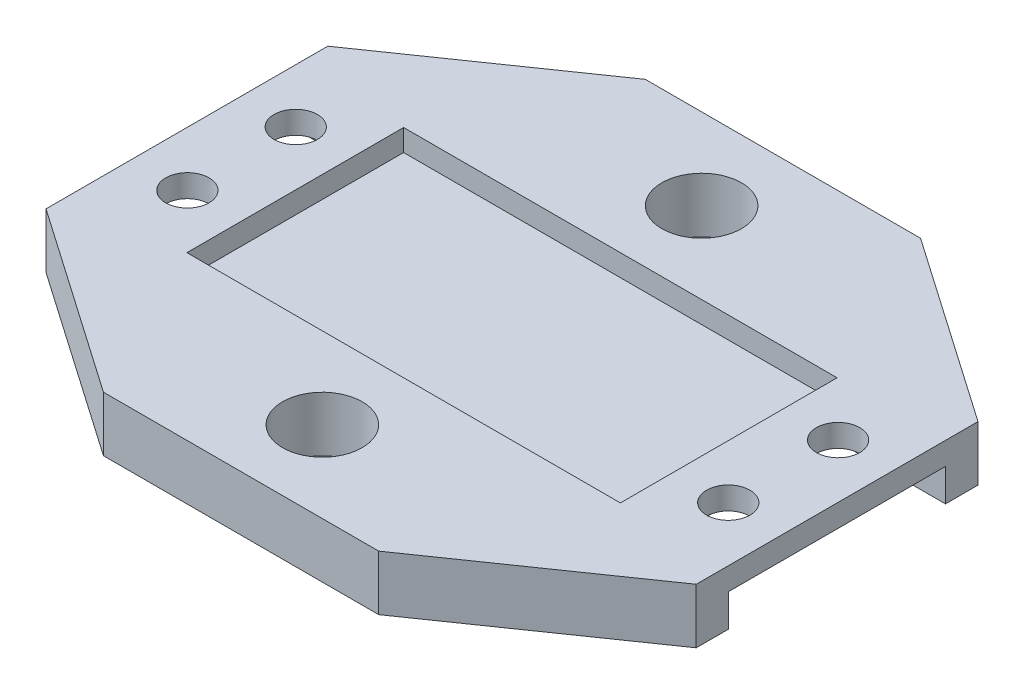
from build123d import *

# Parameters (mm, degrees)
SKETCH1_W           = 60
SKETCH1_H           = 50
BOSS_EXTRUDE1_DEPTH = 5.08
SKETCH2_OUTSIDE_W   = 77.654
SKETCH2_OUTSIDE_H   = 67.654
SKETCH2_OUTSIDE_R   = 3.675
CUT_EXTRUDE1_DEPTH  = 56.468381585
SKETCH12_W          = 20
SKETCH12_H          = 3
CUT_EXTRUDE6_DEPTH  = 10
SKETCH13_W          = 20
SKETCH13_H          = 3
CUT_EXTRUDE7_DEPTH  = 10
SKETCH14_W          = 40
SKETCH14_H          = 20
CUT_EXTRUDE8_DEPTH  = 2
SKETCH15_R          = 2
CUT_EXTRUDE9_DEPTH  = 56.468381585


with BuildPart() as part:
    # Sketch1 → Boss-Extrude1 (new body)
    with BuildSketch(Plane(origin=(0, 0, 0), x_dir=(1, 0, 0), z_dir=(0, 1, 0))):
        with Locations((-18.058684047, 2.226785401)):
            Rectangle(SKETCH1_W, SKETCH1_H)
    extrude(amount=BOSS_EXTRUDE1_DEPTH)

    # Sketch2 outside → Cut-Extrude1 (cut, through all)
    # profile 1 of 3: a face of its own
    with BuildSketch(Plane(origin=(0, 5.08, 0), x_dir=(1, 0, 0), z_dir=(0, 1, 0))):
        with Locations((-18.059, 2.227)):
            Rectangle(SKETCH2_OUTSIDE_W, SKETCH2_OUTSIDE_H)
        Polygon((-30.758684047, 27.226785401), (-5.358684047, 27.226785401), (11.941315953, 15.226785401), (11.941315953, -10.773214599), (-5.358684047, -22.773214599), (-30.758684047, -22.773214599), (-48.058684047, -10.773214599), (-48.058684047, 15.226785401), align=None, mode=Mode.SUBTRACT)
    # profile 2 of 3: a face of its own
    with BuildSketch(Plane(origin=(0, 5.08, 0), x_dir=(1, 0, 0), z_dir=(0, 1, 0))):
        with Locations((-18.058684047, 19.726785401)):
            Circle(SKETCH2_OUTSIDE_R)
    # profile 3 of 3: a face of its own
    with BuildSketch(Plane(origin=(0, 5.08, 0), x_dir=(1, 0, 0), z_dir=(0, 1, 0))):
        with Locations((-18.058684047, -15.273214599)):
            Circle(SKETCH2_OUTSIDE_R)
    extrude(amount=-CUT_EXTRUDE1_DEPTH, mode=Mode.SUBTRACT)

    # Sketch12 → Cut-Extrude6 (cut)
    with BuildSketch(Plane.ZY.offset(48.058684047)):
        with Locations((-2.185006669, 1.5)):
            Rectangle(SKETCH12_W, SKETCH12_H)
    extrude(amount=-CUT_EXTRUDE6_DEPTH, mode=Mode.SUBTRACT)

    # Sketch13 → Cut-Extrude7 (cut)
    with BuildSketch(Plane(origin=(11.941315953, 0, 0), x_dir=(0, 0, -1), z_dir=(1, 0, 0))):
        with Locations((2.226785401, 1.5)):
            Rectangle(SKETCH13_W, SKETCH13_H)
    extrude(amount=-CUT_EXTRUDE7_DEPTH, mode=Mode.SUBTRACT)

    # Sketch14 → Cut-Extrude8 (cut)
    with BuildSketch(Plane(origin=(0, 5.08, 0), x_dir=(1, 0, 0), z_dir=(0, 1, 0))):
        with Locations((-18.058684047, 2.226785401)):
            Rectangle(SKETCH14_W, SKETCH14_H)
    extrude(amount=-CUT_EXTRUDE8_DEPTH, mode=Mode.SUBTRACT)

    # Sketch15 → Cut-Extrude9 (cut, through all)
    with BuildSketch(Plane(origin=(0, 5.08, 0), x_dir=(1, 0, 0), z_dir=(0, 1, 0))):
        with Locations((-43.015186805, -2.773214599)):
            Circle(SKETCH15_R)
        with Locations((-43.081568636, 7.292867381)):
            Circle(SKETCH15_R)
        with Locations((6.964200542, 7.292867381)):
            Circle(SKETCH15_R)
        with Locations((6.89781871, -2.773214599)):
            Circle(SKETCH15_R)
    extrude(amount=-CUT_EXTRUDE9_DEPTH, mode=Mode.SUBTRACT)


solid = part.part
